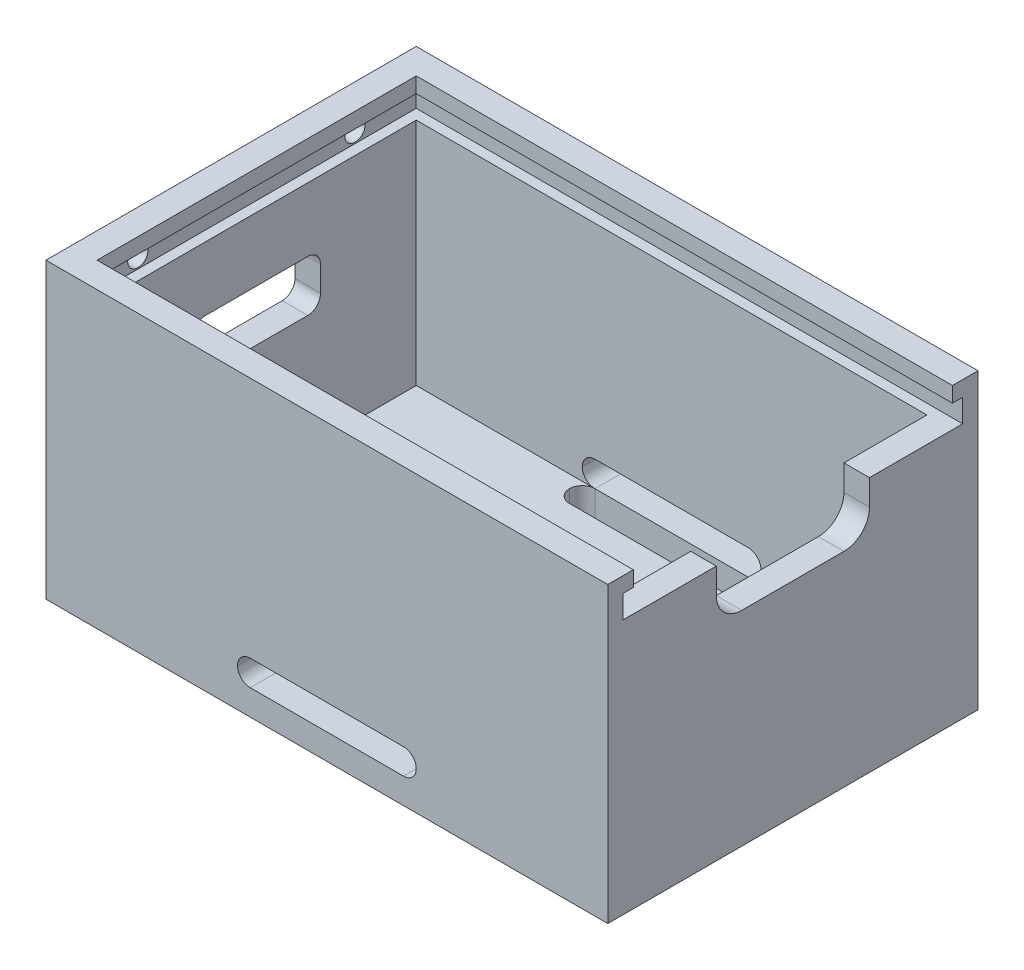
from build123d import *

# Parameters (mm, degrees)
SKETCH_1_W             = 44
SKETCH_1_H             = 29
EXTRUDE_1_DEPTH        = 23
SHELL_1_T              = -2
CUT_EXTRUDE_1_REACH    = 53.723
SKETCH_2_W             = 12
SKETCH_2_H             = 7
CUT_EXTRUDE_2_REACH    = 52.032
SKETCH_3_W             = 10
SKETCH_3_H             = 4
FILLET_1_R             = 1
FILLET_2_R             = 2
CUT_EXTRUDE_START      = -2
SKETCH_4_W             = 25
SKETCH_4_H             = 3
CUT_EXTRUDE_3_DEPTH    = 2
SKETCH_5_W             = 26.6
SKETCH_5_H             = 1.8
CUT_EXTRUDE_4_DEPTH    = 42.8
CUT_EXTRUDE_5_REACH    = 53.723
SKETCH_6_R             = 0.8
CUT_EXTRUDE_6_REACH    = 36.975
SKETCH_8_W             = 14
SKETCH_8_H             = 2
CUT_EXTRUDE_7_REACH    = 45.058
SKETCH_9_W             = 14
SKETCH_9_H             = 2
FILLET_3_R             = 1
FILLET_4_R             = 1
FILLET_3_OF_MIRROR_1_R = 1
FILLET_4_OF_MIRROR_1_R = 1


# Some blends are built 0.0001 mm under size
with BuildPart() as part:
    # 草图1 → 凸台-拉伸1 (new body)
    with BuildSketch(Plane(origin=(0, 0, 0), x_dir=(1, 0, 0), z_dir=(0, 1, 0))):
        Rectangle(SKETCH_1_W, SKETCH_1_H)
    extrude(amount=EXTRUDE_1_DEPTH)

    # 抽壳1
    shell_1_openings = [part.faces().sort_by_distance(p)[0] for p in [
        (0, 23, 0),
    ]]
    offset(amount=SHELL_1_T, openings=shell_1_openings, kind=Kind.INTERSECTION)

    # 草图2 → 切除-拉伸1 (cut, up to next)
    with BuildSketch(Plane(origin=(22, 0, 0), x_dir=(0, 0, -1), z_dir=(1, 0, 0)), mode=Mode.PRIVATE) as cut_extrude_1_sk1:
        with Locations((0, 19.5)):
            Rectangle(SKETCH_2_W, SKETCH_2_H)
    cut_extrude_1_tool1 = extrude(cut_extrude_1_sk1.sketch, amount=-CUT_EXTRUDE_1_REACH, mode=Mode.PRIVATE) & part.part
    add(cut_extrude_1_tool1.solids().sort_by_distance((22, 19.5, 0))[0], mode=Mode.SUBTRACT)

    # 草图3 → 切除-拉伸2 (cut, up to next)
    with BuildSketch(Plane(origin=(-20, 0, 0), x_dir=(0, 0, -1), z_dir=(1, 0, 0)), mode=Mode.PRIVATE) as cut_extrude_2_sk1:
        with Locations((0, 13)):
            Rectangle(SKETCH_3_W, SKETCH_3_H)
    cut_extrude_2_tool1 = extrude(cut_extrude_2_sk1.sketch, amount=-CUT_EXTRUDE_2_REACH, mode=Mode.PRIVATE) & part.part
    add(cut_extrude_2_tool1.solids().sort_by_distance((-20, 13, 0))[0], mode=Mode.SUBTRACT)

    # 圆角1
    fillet_1_edges = [part.edges().sort_by_distance(p)[0] for p in [
        (-21, 11, 5),
        (-21, 15, 5),
        (-21, 15, -5),
        (-21, 11, -5),
    ]]
    fillet(fillet_1_edges, radius=FILLET_1_R)

    # 圆角2
    fillet_2_edges = [part.edges().sort_by_distance(p)[0] for p in [
        (21, 16, 6),
        (21, 16, -6),
    ]]
    fillet(fillet_2_edges, radius=FILLET_2_R)

    # 草图4 → 切除-拉伸3 (cut)
    with BuildSketch(Plane(origin=(22, 0, 0), x_dir=(0, 0, -1), z_dir=(1, 0, 0)).offset(CUT_EXTRUDE_START)):
        with Locations((0, 21.5)):
            Rectangle(SKETCH_4_W, SKETCH_4_H)
    extrude(amount=CUT_EXTRUDE_3_DEPTH, mode=Mode.SUBTRACT)

    # 草图5 → 切除-拉伸4 (cut)
    with BuildSketch(Plane(origin=(22, 0, 0), x_dir=(0, 0, -1), z_dir=(1, 0, 0))):
        with Locations((0, 20.9)):
            Rectangle(SKETCH_5_W, SKETCH_5_H)
    extrude(amount=-CUT_EXTRUDE_4_DEPTH, mode=Mode.SUBTRACT)

    # 草图6 → 切除-拉伸5 (cut, up to next)
    with BuildSketch(Plane.ZY.offset(22), mode=Mode.PRIVATE) as cut_extrude_5_sk1:
        with Locations((-8.5, 20.9)):
            Circle(SKETCH_6_R)
    cut_extrude_5_tool1 = extrude(cut_extrude_5_sk1.sketch, amount=-CUT_EXTRUDE_5_REACH, mode=Mode.PRIVATE) & part.part
    # 草图6 → 切除-拉伸5 (cut, up to next)
    with BuildSketch(Plane.ZY.offset(22), mode=Mode.PRIVATE) as cut_extrude_5_sk2:
        with Locations((8.5, 20.9)):
            Circle(SKETCH_6_R)
    cut_extrude_5_tool2 = extrude(cut_extrude_5_sk2.sketch, amount=-CUT_EXTRUDE_5_REACH, mode=Mode.PRIVATE) & part.part
    add(cut_extrude_5_tool1.solids().sort_by_distance((-22, 20.9, -8.5))[0], mode=Mode.SUBTRACT)
    add(cut_extrude_5_tool2.solids().sort_by_distance((-22, 20.9, 8.5))[0], mode=Mode.SUBTRACT)

    # 草图8 → 切除-拉伸6 (cut, up to next)
    with BuildSketch(Plane.XZ, mode=Mode.PRIVATE) as cut_extrude_6_sk1:
        with Locations((0, -11.5)):
            Rectangle(SKETCH_8_W, SKETCH_8_H)
    cut_extrude_6_tool1 = extrude(cut_extrude_6_sk1.sketch, amount=-CUT_EXTRUDE_6_REACH, mode=Mode.PRIVATE) & part.part
    cut_extrude_6 = cut_extrude_6_tool1.solids().sort_by_distance((0, 0, -11.5))[0]
    add(cut_extrude_6, mode=Mode.SUBTRACT)

    # 草图9 → 切除-拉伸7 (cut, up to next)
    with BuildSketch(Plane(origin=(0, 0, -14.5), x_dir=(-1, 0, 0), z_dir=(0, 0, -1)), mode=Mode.PRIVATE) as cut_extrude_7_sk1:
        with Locations((0, 3)):
            Rectangle(SKETCH_9_W, SKETCH_9_H)
    cut_extrude_7_tool1 = extrude(cut_extrude_7_sk1.sketch, amount=-CUT_EXTRUDE_7_REACH, mode=Mode.PRIVATE) & part.part
    cut_extrude_7 = cut_extrude_7_tool1.solids().sort_by_distance((0, 3, -14.5))[0]
    add(cut_extrude_7, mode=Mode.SUBTRACT)

    # 圆角3
    # the kernel refuses this fillet: 1 mm, written as the material it adds along each edge
    with BuildSketch(Plane(origin=(-7, 4, -14.5), x_dir=(0, -1, 0), z_dir=(0, 0, 1)), Plane(origin=(-7, 2, -14.5), x_dir=(1, 0, 0), z_dir=(0, 0, 1)), Plane(origin=(7, 2, -14.5), x_dir=(0, 1, 0), z_dir=(0, 0, 1))) as fillet_3_piece_1:
        with BuildLine():
            CenterArc((FILLET_3_R, FILLET_3_R), FILLET_3_R, 180, 90)
            Line((0, FILLET_3_R), (0, 0))
            Line((0, 0), (FILLET_3_R, 0))
        make_face()
    extrude(amount=2)
    with BuildSketch(Plane(origin=(7, 4, -14.5), x_dir=(0, -1, 0), z_dir=(0, 0, 1))) as fillet_3_piece_2:
        with BuildLine():
            CenterArc((FILLET_3_R, -FILLET_3_R), FILLET_3_R, 90, 90)
            Line((0, -FILLET_3_R), (0, 0))
            Line((0, 0), (FILLET_3_R, 0))
        make_face()
    extrude(amount=2)

    # 圆角4
    fillet_4_edges = [part.edges().sort_by_distance(p)[0] for p in [
        (-7, 1, -12.5),
        (-7, 1, -10.5),
        (7, 1, -12.5),
        (7, 1, -10.5),
    ]]
    fillet(fillet_4_edges, radius=FILLET_4_R - 0.0001)  # a hair under: the kernel refuses the full size

    # 镜向1: 切除-拉伸6, 切除-拉伸7 across plane
    add(cut_extrude_6.mirror(Plane.XY), mode=Mode.SUBTRACT)
    add(cut_extrude_7.mirror(Plane.XY), mode=Mode.SUBTRACT)

    # 圆角3 of 镜向1
    # the kernel refuses this fillet: 1 mm, written as the material it adds along each edge
    with BuildSketch(Plane(origin=(-7, 4, 14.5), x_dir=(1, 0, 0), z_dir=(0, 0, -1)), Plane(origin=(-7, 2, 14.5), x_dir=(0, 1, 0), z_dir=(0, 0, -1)), Plane(origin=(7, 2, 14.5), x_dir=(-1, 0, 0), z_dir=(0, 0, -1))) as fillet_3_of_mirror_1_piece_1:
        with BuildLine():
            CenterArc((FILLET_3_OF_MIRROR_1_R, FILLET_3_OF_MIRROR_1_R), FILLET_3_OF_MIRROR_1_R, 180, 90)
            Line((0, FILLET_3_OF_MIRROR_1_R), (0, 0))
            Line((0, 0), (FILLET_3_OF_MIRROR_1_R, 0))
        make_face()
    extrude(amount=2)
    with BuildSketch(Plane(origin=(7, 4, 14.5), x_dir=(-1, 0, 0), z_dir=(0, 0, -1))) as fillet_3_of_mirror_1_piece_2:
        with BuildLine():
            CenterArc((FILLET_3_OF_MIRROR_1_R, -FILLET_3_OF_MIRROR_1_R), FILLET_3_OF_MIRROR_1_R, 90, 90)
            Line((0, -FILLET_3_OF_MIRROR_1_R), (0, 0))
            Line((0, 0), (FILLET_3_OF_MIRROR_1_R, 0))
        make_face()
    extrude(amount=2)

    # 圆角4 of 镜向1
    fillet_4_of_mirror_1_edges = [part.edges().sort_by_distance(p)[0] for p in [
        (-7, 1, 12.5),
        (-7, 1, 10.5),
        (7, 1, 12.5),
        (7, 1, 10.5),
    ]]
    fillet(fillet_4_of_mirror_1_edges, radius=FILLET_4_OF_MIRROR_1_R - 0.0001)  # a hair under: the kernel refuses the full size


solid = part.part
